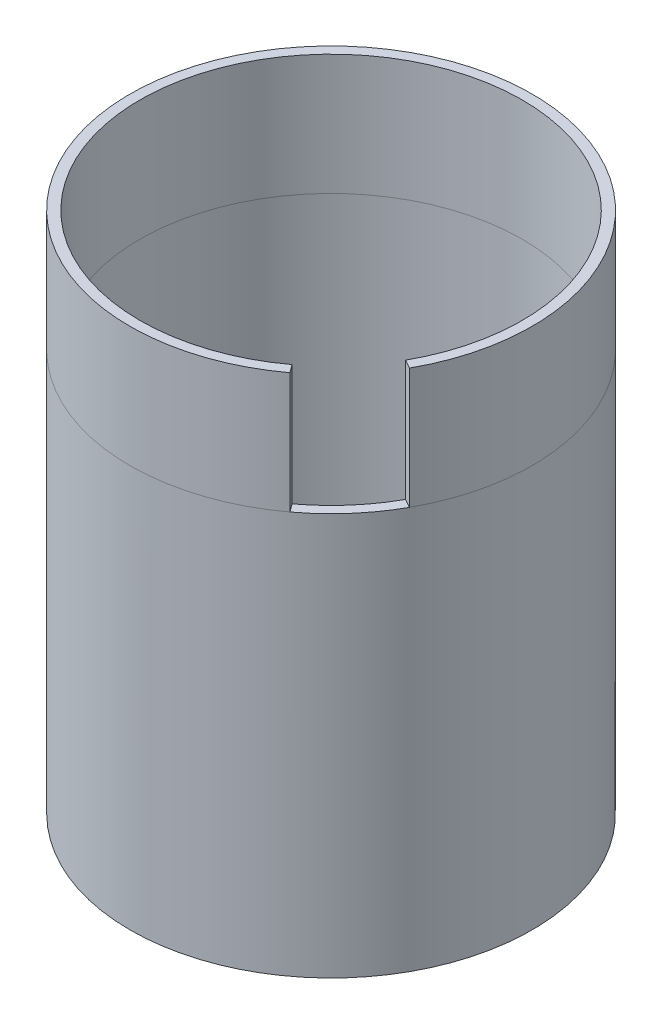
from build123d import *

# Parameters (mm, degrees)
SKETCH_1_R      = 5
SKETCH_1_R_2    = 4.75
EXTRUDE_3_DEPTH = 10
EXTRUDE_5_DEPTH = 3


with BuildPart() as part:
    # 草圖1 → 填料-伸長3 (new body)
    with BuildSketch(Plane(origin=(0, 0, 0), x_dir=(1, 0, 0), z_dir=(0, 1, 0))):
        Circle(SKETCH_1_R)
        Circle(SKETCH_1_R_2, mode=Mode.SUBTRACT)
    extrude(amount=EXTRUDE_3_DEPTH)

    # 草圖2 → 填料-伸長5 (add)
    with BuildSketch(Plane(origin=(0, 10, 0), x_dir=(1, 0, 0), z_dir=(0, 1, 0))):
        with BuildLine():
            Line((2.838234404, -3.808795803), (2.987635913, -4.009243277))
            ThreePointArc((2.987635913, -4.009243277), (-3.76819109, 3.293473376), (4.37304783, -2.424139574))
            Line((4.37304783, -2.424139574), (4.154407358, -2.302911094))
            ThreePointArc((4.154407358, -2.302911094), (-3.579955501, 3.128951756), (2.838234404, -3.808795803))
        make_face()
    extrude(amount=EXTRUDE_5_DEPTH)


solid = part.part
